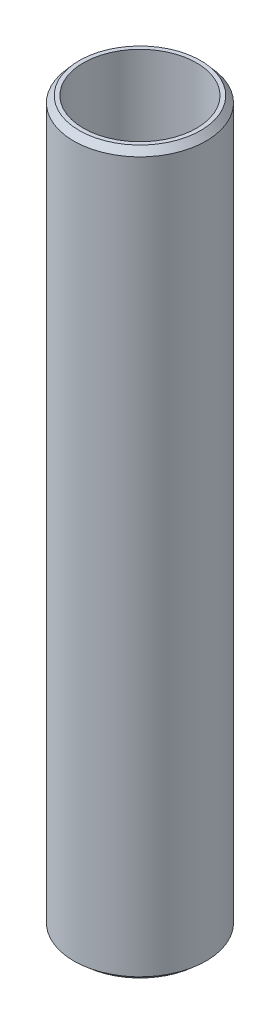
from build123d import *
from OCP.BRepFilletAPI import BRepFilletAPI_MakeChamfer

# Parameters (mm, degrees)
SKETCH1_R           = 55
BOSS_EXTRUDE1_DEPTH = 600
SKETCH2_R           = 47.065496979
CUT_EXTRUDE1_DEPTH  = 606.020660804
CHAMFER1_SIZE       = 5.279717323
CHAMFER1_SIZE2      = 4.583971716


with BuildPart() as part:
    # Sketch1 → Boss-Extrude1 (new body)
    with BuildSketch(Plane(origin=(0, 0, 0), x_dir=(1, 0, 0), z_dir=(0, 1, 0))):
        Circle(SKETCH1_R)
    extrude(amount=BOSS_EXTRUDE1_DEPTH)

    # Sketch2 → Cut-Extrude1 (cut, through all)
    with BuildSketch(Plane(origin=(0, 0, 0), x_dir=(1, 0, 0), z_dir=(0, 1, 0))):
        Circle(SKETCH2_R)
    extrude(amount=CUT_EXTRUDE1_DEPTH, mode=Mode.SUBTRACT)

    # Chamfer1: one chamfer whose edges measure the first distance from different faces: ONE call of the kernel's chamfer builder (chamfer() names one face for all edges)
    chamfer1_edges_1 = [part.edges().sort_by_distance(p)[0] for p in [
        (-55, 600, 0),
    ]]
    chamfer1_side_1 = [part.faces().sort_by_distance(p)[0] for p in [
        (-55, 300, 0),
    ]]
    chamfer1_edges_2 = [part.edges().sort_by_distance(p)[0] for p in [
        (-55, 0, 0),
    ]]
    chamfer1_side_2 = [part.faces().sort_by_distance(p)[0] for p in [
        (-53.444365081, 0, 0),
    ]]
    chamfer1 = BRepFilletAPI_MakeChamfer(part.part.solid().wrapped)
    for e in chamfer1_edges_1:
        chamfer1.Add(CHAMFER1_SIZE, CHAMFER1_SIZE2, e.wrapped, chamfer1_side_1[0].wrapped)  # the first distance lies on this face
    for e in chamfer1_edges_2:
        chamfer1.Add(CHAMFER1_SIZE, CHAMFER1_SIZE2, e.wrapped, chamfer1_side_2[0].wrapped)  # the first distance lies on this face
    add(Compound.cast(chamfer1.Shape()), mode=Mode.REPLACE)


solid = part.part
